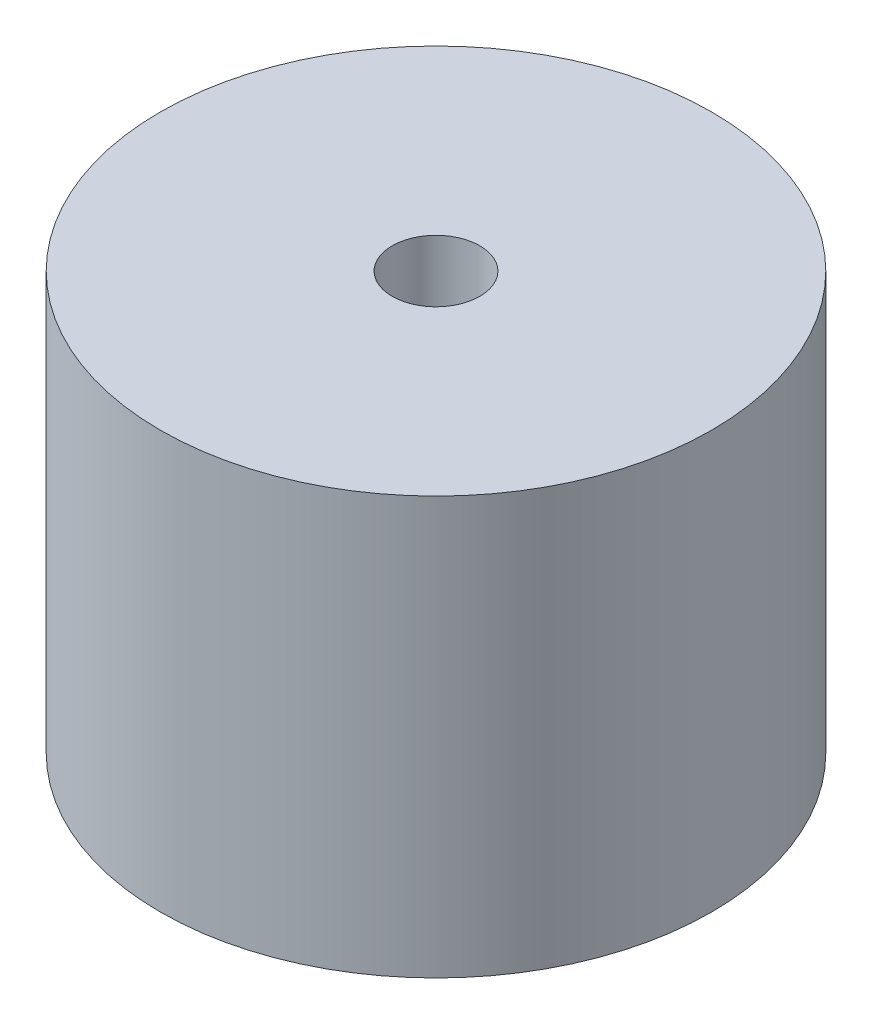
from build123d import *

# Parameters (mm, degrees)
SKETCH1_R           = 13.21
SKETCH1_R_2         = 2.1
BOSS_EXTRUDE1_DEPTH = 20


with BuildPart() as part:
    # Sketch1 → Boss-Extrude1 (new body)
    with BuildSketch(Plane(origin=(0, 0, 0), x_dir=(1, 0, 0), z_dir=(0, 1, 0))):
        Circle(SKETCH1_R)
        Circle(SKETCH1_R_2, mode=Mode.SUBTRACT)
    extrude(amount=BOSS_EXTRUDE1_DEPTH)


solid = part.part
